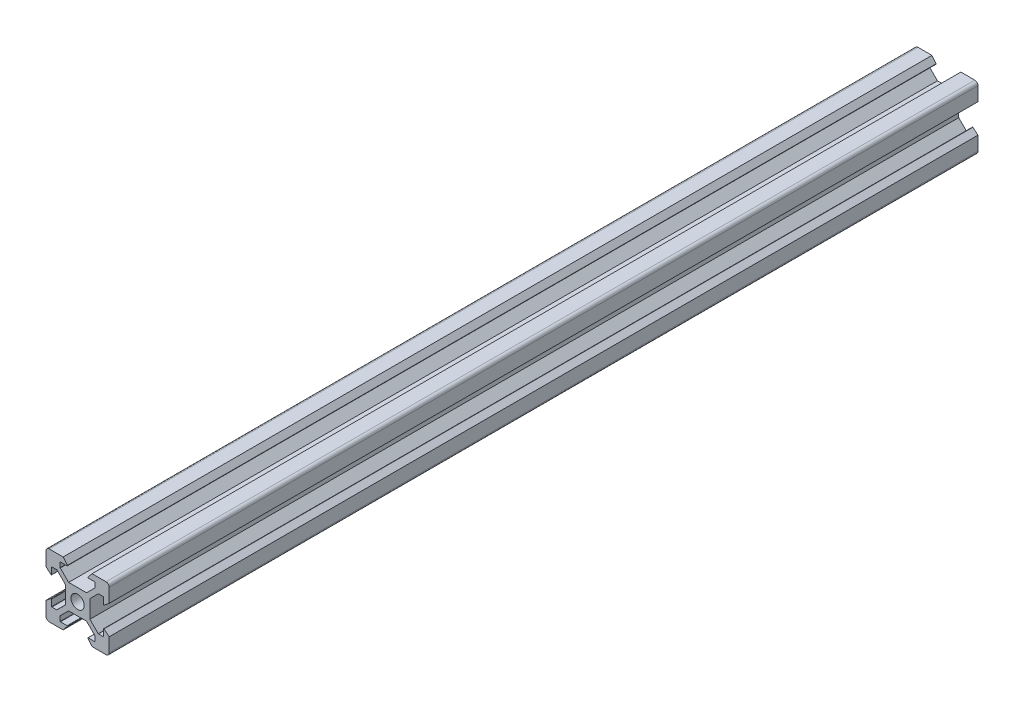
from build123d import *

# Parameters (mm, degrees)
SKETCH1_R           = 2.1
BOSS_EXTRUDE1_DEPTH = 275
FILLET1_R           = 1


with BuildPart() as part:
    # Sketch1 → Boss-Extrude1 (new body)
    with BuildSketch(Plane.XY):
        with BuildLine():
            Line((-2.839339828, 3.9), (-5.470710678, 6.53137085))
            ThreePointArc((-5.470710678, 6.53137085), (-5.492387953, 6.563813185), (-5.5, 6.602081528))
            Line((-5.5, 6.602081528), (-5.5, 8.1))
            ThreePointArc((-5.5, 8.1), (-5.470710678, 8.170710678), (-5.4, 8.2))
            Line((-5.4, 8.2), (-3.334418044, 8.2))
            ThreePointArc((-3.334418044, 8.2), (-3.244178397, 8.256909326), (-3.2566483, 8.362863876))
            Line((-3.2566483, 8.362863876), (-4.58, 10))
            Line((-4.58, 10), (-10, 10))
            Line((-10, 10), (-10, 4.58))
            Line((-10, 4.58), (-8.362863876, 3.2566483))
            ThreePointArc((-8.362863876, 3.2566483), (-8.256909326, 3.244178397), (-8.2, 3.334418044))
            Line((-8.2, 3.334418044), (-8.2, 5.4))
            ThreePointArc((-8.2, 5.4), (-8.170710678, 5.470710678), (-8.1, 5.5))
            Line((-8.1, 5.5), (-6.602081528, 5.5))
            ThreePointArc((-6.602081528, 5.5), (-6.563813185, 5.492387953), (-6.53137085, 5.470710678))
            Line((-6.53137085, 5.470710678), (-3.9, 2.839339828))
            Line((-3.9, 2.839339828), (-3.9, -2.839339828))
            Line((-3.9, -2.839339828), (-6.53137085, -5.470710678))
            ThreePointArc((-6.53137085, -5.470710678), (-6.563813185, -5.492387953), (-6.602081528, -5.5))
            Line((-6.602081528, -5.5), (-8.1, -5.5))
            ThreePointArc((-8.1, -5.5), (-8.170710678, -5.470710678), (-8.2, -5.4))
            Line((-8.2, -5.4), (-8.2, -3.334418044))
            ThreePointArc((-8.2, -3.334418044), (-8.256909326, -3.244178397), (-8.362863876, -3.2566483))
            Line((-8.362863876, -3.2566483), (-10, -4.58))
            Line((-10, -4.58), (-10, -10))
            Line((-10, -10), (-4.58, -10))
            Line((-4.58, -10), (-3.2566483, -8.362863876))
            ThreePointArc((-3.2566483, -8.362863876), (-3.244178397, -8.256909326), (-3.334418044, -8.2))
            Line((-3.334418044, -8.2), (-5.4, -8.2))
            ThreePointArc((-5.4, -8.2), (-5.470710678, -8.170710678), (-5.5, -8.1))
            Line((-5.5, -8.1), (-5.5, -6.602081528))
            ThreePointArc((-5.5, -6.602081528), (-5.492387953, -6.563813185), (-5.470710678, -6.53137085))
            Line((-5.470710678, -6.53137085), (-2.839339828, -3.9))
            Line((-2.839339828, -3.9), (2.839339828, -3.9))
            Line((2.839339828, -3.9), (5.470710678, -6.53137085))
            ThreePointArc((5.470710678, -6.53137085), (5.492387953, -6.563813185), (5.5, -6.602081528))
            Line((5.5, -6.602081528), (5.5, -8.1))
            ThreePointArc((5.5, -8.1), (5.470710678, -8.170710678), (5.4, -8.2))
            Line((5.4, -8.2), (3.334418044, -8.2))
            ThreePointArc((3.334418044, -8.2), (3.244178397, -8.256909326), (3.2566483, -8.362863876))
            Line((3.2566483, -8.362863876), (4.58, -10))
            Line((4.58, -10), (10, -10))
            Line((10, -10), (10, -4.58))
            Line((10, -4.58), (8.362863876, -3.2566483))
            ThreePointArc((8.362863876, -3.2566483), (8.256909326, -3.244178397), (8.2, -3.334418044))
            Line((8.2, -3.334418044), (8.2, -5.4))
            ThreePointArc((8.2, -5.4), (8.170710678, -5.470710678), (8.1, -5.5))
            Line((8.1, -5.5), (6.602081528, -5.5))
            ThreePointArc((6.602081528, -5.5), (6.563813185, -5.492387953), (6.53137085, -5.470710678))
            Line((6.53137085, -5.470710678), (3.9, -2.839339828))
            Line((3.9, -2.839339828), (3.9, 2.839339828))
            Line((3.9, 2.839339828), (6.53137085, 5.470710678))
            ThreePointArc((6.53137085, 5.470710678), (6.563813185, 5.492387953), (6.602081528, 5.5))
            Line((6.602081528, 5.5), (8.1, 5.5))
            ThreePointArc((8.1, 5.5), (8.170710678, 5.470710678), (8.2, 5.4))
            Line((8.2, 5.4), (8.2, 3.334418044))
            ThreePointArc((8.2, 3.334418044), (8.256909326, 3.244178397), (8.362863876, 3.2566483))
            Line((8.362863876, 3.2566483), (10, 4.58))
            Line((10, 4.58), (10, 10))
            Line((10, 10), (4.58, 10))
            Line((4.58, 10), (3.2566483, 8.362863876))
            ThreePointArc((3.2566483, 8.362863876), (3.244178397, 8.256909326), (3.334418044, 8.2))
            Line((3.334418044, 8.2), (5.4, 8.2))
            ThreePointArc((5.4, 8.2), (5.470710678, 8.170710678), (5.5, 8.1))
            Line((5.5, 8.1), (5.5, 6.602081528))
            ThreePointArc((5.5, 6.602081528), (5.492387953, 6.563813185), (5.470710678, 6.53137085))
            Line((5.470710678, 6.53137085), (2.839339828, 3.9))
            Line((2.839339828, 3.9), (-2.839339828, 3.9))
        make_face()
        Circle(SKETCH1_R, mode=Mode.SUBTRACT)
    extrude(amount=BOSS_EXTRUDE1_DEPTH)

    # Fillet1
    fillet1_edges = [part.edges().sort_by_distance(p)[0] for p in [
        (10, -10, 137.5),
        (10, 10, 137.5),
        (-10, -10, 137.5),
        (-10, 10, 137.5),
    ]]
    fillet(fillet1_edges, radius=FILLET1_R)


solid = part.part
